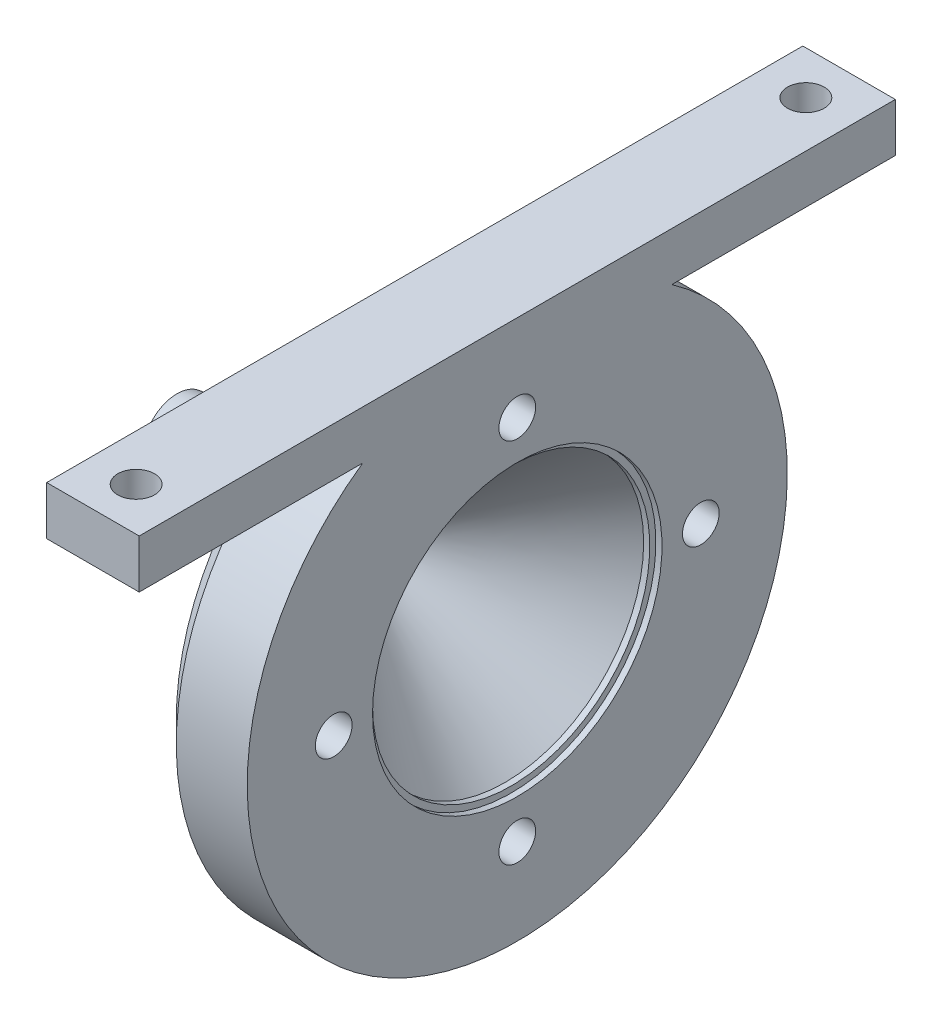
from build123d import *

# Parameters (mm, degrees)
M3_CLEARANCE_HOLE1_D     = 3.4
M3_CLEARANCE_HOLE1_DEPTH = 8.566
M3_CLEARANCE_HOLE1_TIP   = 1.021463052
CHAMFER1_SIZE            = 2
SKETCH1_11_W             = 8.566
SKETCH1_11_H             = 4.5
BOSS_EXTRUDE1_DEPTH      = 35
SKETCH9_R                = 1.7
CUT_EXTRUDE1_DEPTH       = 10


with BuildPart() as part:
    # Sketch1 → Revolve17 (revolve)
    with BuildSketch(Plane.XY):
        Polygon((-14.010170791, 3.8), (-14.010170791, 3.15), (-9.676837458, 3.8), (-9.676837458, 3.15), (-5.343504124, 3.8), (4.596253634, 12.834), (4.596253634, 25), (13.162253634, 25), (13.162253634, 13.4), (12.596253634, 13.4), (12.596253634, 12.834), (12.030253634, 12.834), (0, 1.9), (-18.343504124, 1.9), (-18.343504124, 3.15), align=None)
    revolve(axis=Axis((-801.920554309, 0, 0), (1, 0, 0)))

    # M3 Clearance Hole1
    with Locations(Plane.ZY.offset(-4.596253634)):
        with Locations((0, -16.994664238), (0, 16.994664238), (16.994664238, 0), (-16.994664238, 0)):
            Hole(M3_CLEARANCE_HOLE1_D / 2, depth=M3_CLEARANCE_HOLE1_DEPTH)
            with Locations((0, 0, -(M3_CLEARANCE_HOLE1_DEPTH + M3_CLEARANCE_HOLE1_TIP / 2))):  # 118° drill point
                Cone(0, M3_CLEARANCE_HOLE1_D / 2, M3_CLEARANCE_HOLE1_TIP, mode=Mode.SUBTRACT)

    # Chamfer1
    chamfer1_edges = [part.edges().sort_by_distance(p)[0] for p in [
        (4.596253634, -25, 0),
    ]]
    chamfer(chamfer1_edges, length=CHAMFER1_SIZE)

    # Sketch1<11> → Boss-Extrude1 (add, symmetric)
    with BuildSketch(Plane.XY):
        with Locations((8.879253634, 22.75)):
            Rectangle(SKETCH1_11_W, SKETCH1_11_H)
    extrude(amount=BOSS_EXTRUDE1_DEPTH, both=True)

    # Sketch9 → Cut-Extrude1 (cut)
    with BuildSketch(Plane(origin=(0, 20.5, 0), x_dir=(-1, 0, 0), z_dir=(0, -1, 0))):
        with Locations((-8.879253634, -31)):
            Circle(SKETCH9_R)
        with Locations((-8.879253634, 31)):
            Circle(SKETCH9_R)
    extrude(amount=-CUT_EXTRUDE1_DEPTH, mode=Mode.SUBTRACT)


solid = part.part
